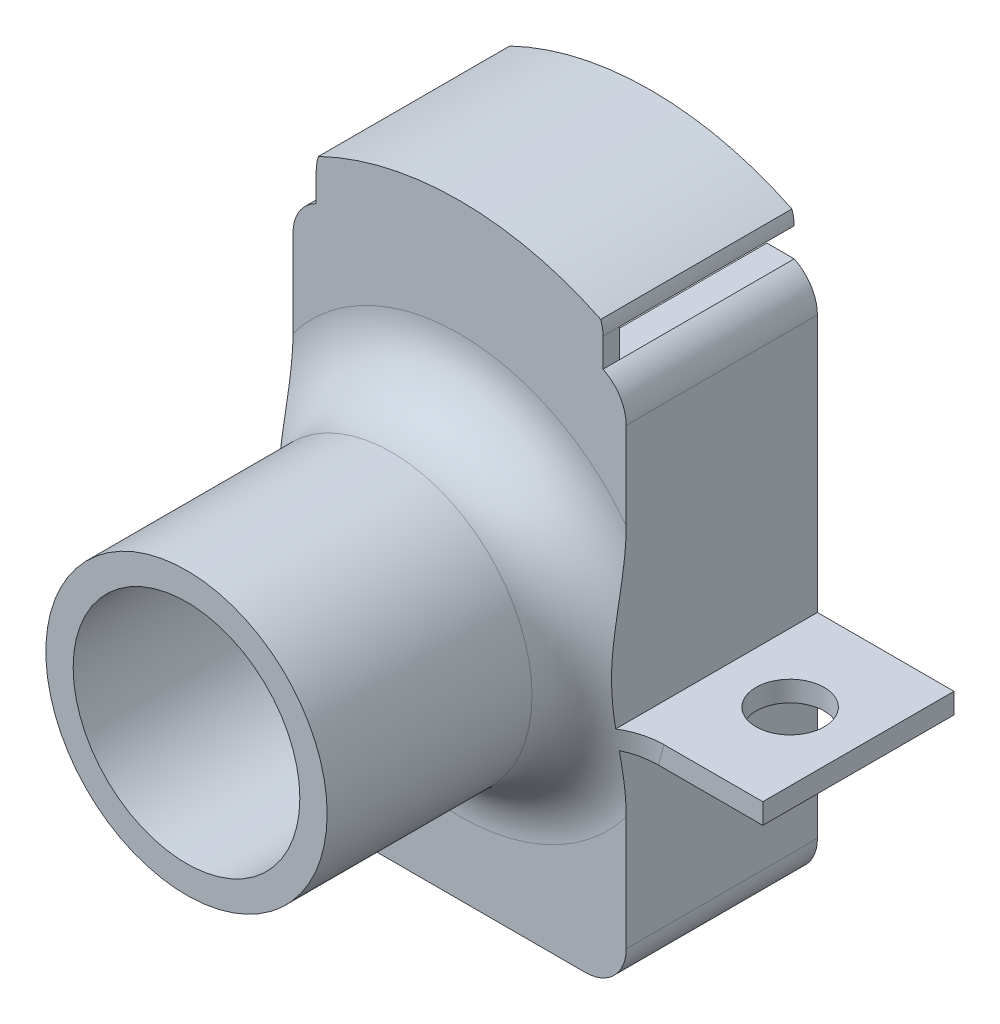
from build123d import *

# Parameters (mm, degrees)
SKETCH2_R            = 6.564013765
BATTERY_HOLDER_DEPTH = 16.256
CUT_EXTRUDE3_START   = -26.416
CUT_EXTRUDE3_DEPTH   = 26.416
SKETCH3_R            = 3.175
PANEL_MOUNT_DEPTH    = 16.256


with BuildPart() as part:
    # Sketch1 → Body (revolve)
    with BuildSketch(Plane(origin=(0, 0, 0), x_dir=(0, 0, -1), z_dir=(1, 0, 0))):
        with BuildLine():
            Line((0, 10.541), (25.4, 10.541))
            Line((25.4, 10.541), (25.4, 6.564013765))
            Line((25.4, 6.564013765), (43.18, 6.564013765))
            Line((43.18, 6.564013765), (43.18, 30.1625))
            Line((43.18, 30.1625), (25.4, 30.1625))
            Line((25.4, 30.1625), (25.4, 19.431))
            ThreePointArc((25.4, 19.431), (23.540128061, 14.940871939), (19.05, 13.081))
            Line((19.05, 13.081), (0, 13.081))
            Line((0, 13.081), (0, 10.541))
        make_face()
    revolve(axis=Axis((0, 0, 0), (0, 0, -1)))

    # Sketch2 → Battery holder (cut)
    with BuildSketch(Plane(origin=(0, 0, -43.18), x_dir=(-1, 0, 0), z_dir=(0, 0, -1))):
        with BuildLine():
            ThreePointArc((-12.954, -22.352), (-12.582025612, -23.250025612), (-11.684, -23.622))
            Line((-11.684, -23.622), (11.684, -23.622))
            ThreePointArc((11.684, -23.622), (12.582025612, -23.250025612), (12.954, -22.352))
            Line((12.954, -22.352), (12.954, 19.812))
            ThreePointArc((12.954, 19.812), (12.582025612, 20.710025612), (11.684, 21.082))
            Line((11.684, 21.082), (10.795, 21.082))
            Line((10.795, 21.082), (10.795, 25.908))
            ThreePointArc((10.795, 25.908), (10.423025612, 26.806025612), (9.525, 27.178))
            Line((9.525, 27.178), (-9.525, 27.178))
            ThreePointArc((-9.525, 27.178), (-10.423025612, 26.806025612), (-10.795, 25.908))
            Line((-10.795, 25.908), (-13.335, 25.908))
            Line((-13.335, 25.908), (-13.335, 23.245700482))
            Line((-13.335, 23.245700482), (-10.795, 23.245700482))
            Line((-10.795, 23.245700482), (-10.795, 21.082))
            Line((-10.795, 21.082), (-11.684, 21.082))
            ThreePointArc((-11.684, 21.082), (-12.582025612, 20.710025612), (-12.954, 19.812))
            Line((-12.954, 19.812), (-12.954, -22.352))
        make_face()
        Circle(SKETCH2_R, mode=Mode.SUBTRACT)
    extrude(amount=-BATTERY_HOLDER_DEPTH, mode=Mode.SUBTRACT)

    # Sketch2<3> → Cut-Extrude3 (cut)
    with BuildSketch(Plane(origin=(0, 0, -43.18), x_dir=(-1, 0, 0), z_dir=(0, 0, -1)).offset(CUT_EXTRUDE3_START)):
        with BuildLine():
            ThreePointArc((-15.494, 19.812), (-14.909399975, 21.840027367), (-13.335, 23.245700482))
            Line((-13.335, 23.245700482), (-13.335, 25.908))
            ThreePointArc((-13.335, 25.908), (-13.281952329, 26.54156862), (-13.124286511, 27.157494543))
            ThreePointArc((-13.124286511, 27.157494543), (-16.029895732, -25.550319941), (30.1625, 0))
            ThreePointArc((30.1625, 0), (25.550319941, 16.029895732), (13.124286511, 27.157494543))
            ThreePointArc((13.124286511, 27.157494543), (13.281952329, 26.54156862), (13.335, 25.908))
            Line((13.335, 25.908), (13.335, 23.245700482))
            ThreePointArc((13.335, 23.245700482), (14.909399975, 21.840027367), (15.494, 19.812))
            Line((15.494, 19.812), (15.494, -22.352))
            ThreePointArc((15.494, -22.352), (14.378076836, -25.046076836), (11.684, -26.162))
            Line((11.684, -26.162), (-11.684, -26.162))
            ThreePointArc((-11.684, -26.162), (-14.378076836, -25.046076836), (-15.494, -22.352))
            Line((-15.494, -22.352), (-15.494, -6.060125019))
            Line((-15.494, -6.060125019), (-28.194, -6.060125019))
            Line((-28.194, -6.060125019), (-28.194, -4.155125019))
            Line((-28.194, -4.155125019), (-15.494, -4.155125019))
            Line((-15.494, -4.155125019), (-15.494, 19.812))
        make_face()
    extrude(amount=CUT_EXTRUDE3_DEPTH, mode=Mode.SUBTRACT)

    # Sketch3 → Panel Mount (cut)
    with BuildSketch(Plane.XZ.offset(6.060125019)):
        with Locations((21.844, -34.29)):
            Circle(SKETCH3_R)
    extrude(amount=-PANEL_MOUNT_DEPTH, mode=Mode.SUBTRACT)


solid = part.part
